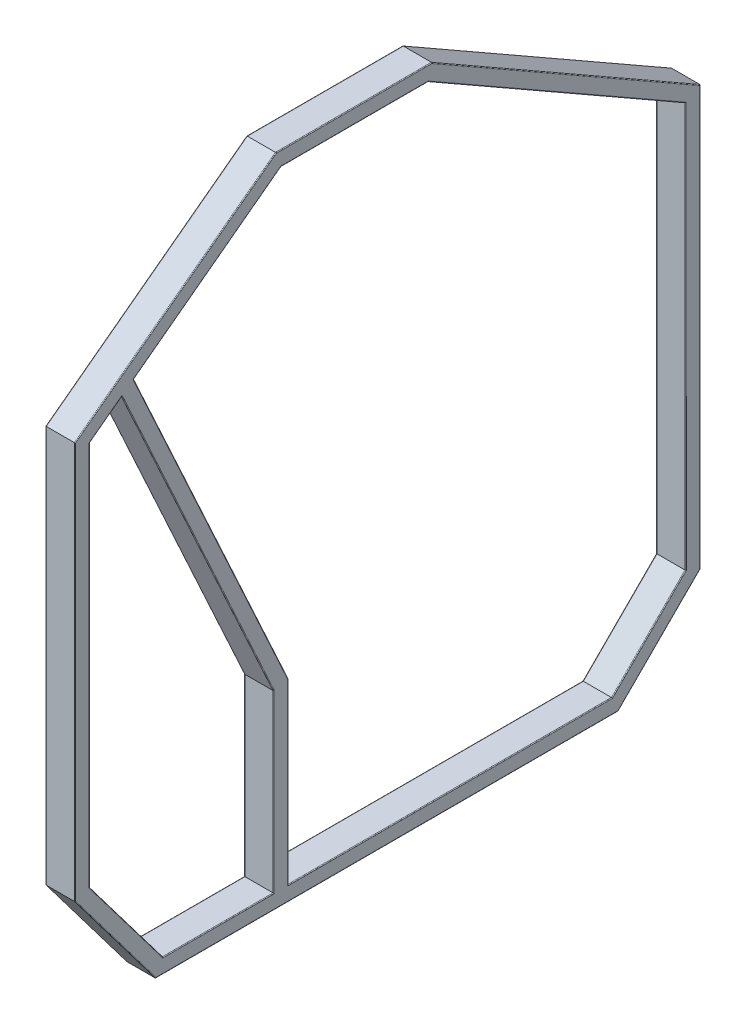
from build123d import *

# Parameters (mm, degrees)
BOSS_EXTRU_1_DEPTH = 80
COQUE1_START       = 4
COQUE1_DEPTH       = 72
CONG_2_R           = 2


# Read off the part's stored shape, not the designer's step: Coque1
with BuildPart() as part:
    # Esquisse1 → Boss.-Extru.1 (new body)
    with BuildSketch(Plane(origin=(0, 0, 0), x_dir=(0, 0, -1), z_dir=(1, 0, 0))):
        Polygon((740, 183.431457505), (740, 1323.212901419), (10.622577483, 1740), (-413.333333333, 1740), (-840, 1420), (-960, 1330), (-960, 250), (-740.540540541, -40), (-419.892357873, -40), (0, -40), (516.568542495, -40), align=None)
        Polygon((-420, 476.25814746), (-420, 26.428571429), (-420, 0), (-450.162628143, 0), (-554.571588527, 0), (-720.648182668, 0), (-920, 263.429187189), (-920, 1310), (-832.74112038, 1375.444159715), (-800, 1304.115290317), align=None, mode=Mode.SUBTRACT)
        Polygon((500, 0), (0, 0), (-380, 0), (-380, 485), (-400, 528.571428571), (-800, 1400), (-400, 1700), (0, 1700), (700, 1300), (700, 200), align=None, mode=Mode.SUBTRACT)
    extrude(amount=BOSS_EXTRU_1_DEPTH)

    # Coque1 outline → Coque1 (cut)
    with BuildSketch(Plane.YZ.offset(COQUE1_START)):
        Polygon((1736, -9.560319735), (1736, 412), (1328, 956), (251.342918719, 956), (-36, 738.551304753), (-36, -514.911688245), (185.088311755, -736), (1320.891611277, -736), align=None)
        Polygon((484.125814746, 384), (1401.263928167, 804.981429111), (1704, 401.333333333), (1704, -1.062257748), (1302.321290142, -704), (198.343145751, -704), (-4, -501.656854249), (-4, 384), align=None, mode=Mode.SUBTRACT)
        Polygon((262.08626847, 924), (1312, 924), (1381.619255939, 831.174325415), (477.132332714, 416), (-4, 416), (-4, 722.637418455), align=None, mode=Mode.SUBTRACT)
    extrude(amount=COQUE1_DEPTH, mode=Mode.SUBTRACT)

    # Congé2
    cong_2_edges = [part.edges().sort_by_distance(p)[0] for p in [
        (80, 942.5, 590),
        (80, 1550, 600),
        (80, 1700, 200),
        (0, 786.714593595, 920),
        (0, 131.714593595, 820.324091334),
        (80, 1500, -350),
        (0, 0, 570.324091334),
        (0, 238.12907373, 420),
        (0, 925.851153588, 626.37056019),
        (0, 1342.722079858, 876.37056019),
        (0, 1740, 201.355377925),
        (0, 1531.606450709, -375.311288741),
        (0, 753.322179462, -740),
        (80, 750, -700),
        (0, 71.715728753, -628.284271247),
        (0, -40, 111.985999023),
        (0, 105, 850.27027027),
        (0, 790, 960),
        (0, 1535, 686.666666667),
        (0, 0, -60),
        (0, 100, -600),
        (80, 100, -600),
        (0, 750, -700),
        (0, 1500, -350),
        (0, 1700, 200),
        (0, 1550, 600),
        (0, 942.5, 590),
        (0, 242.5, 380),
        (80, 0, -60),
        (80, 1535, 686.666666667),
        (80, 790, 960),
        (80, 105, 850.27027027),
        (80, -40, 111.985999023),
        (80, 71.715728753, -628.284271247),
        (80, 753.322179462, -740),
        (80, 1531.606450709, -375.311288741),
        (80, 242.5, 380),
        (76, 1346.80962797, 877.587162708),
        (4, 929.375794326, 623.587162708),
        (76, 236.566166357, 416),
        (76, -4, 569.318709227),
        (80, 1740, 201.355377925),
        (76, 129.043134235, 823.318709227),
        (76, 1532, 684),
        (76, 789.671459359, 956),
        (76, 107.67145936, 847.275652377),
        (76, -36, 111.819808254),
        (4, 74.544155878, -625.455844123),
        (76, 752.989961516, -736),
        (76, 1528.445805639, -372.780159868),
        (76, 240.062907373, 384),
        (76, 942.694871456, 594.490714556),
        (76, 1552.631964083, 603.157381222),
        (4, 1704, 200.135537793),
        (4, 1503.160645071, -352.531128874),
        (4, 750.332217947, -704),
        (76, 97.171572876, -602.828427124),
        (76, 1736, 201.219840132),
        (76, -4, -58.828427125),
        (76, 787.043134235, 924),
        (76, 1704, 200.135537793),
        (76, 1503.160645071, -352.531128874),
        (76, 750.332217947, -704),
        (76, 74.544155878, -625.455844123),
        (80, 1342.722079858, 876.37056019),
        (76, 929.375794326, 623.587162708),
        (4, 240.062907373, 384),
        (4, -4, -58.828427125),
        (4, 97.171572876, -602.828427124),
        (4, 1552.631964083, 603.157381222),
        (4, 942.694871456, 594.490714556),
        (4, 1532, 684),
        (4, 1736, 201.219840132),
        (4, 1528.445805639, -372.780159868),
        (4, 752.989961516, -736),
        (4, -36, 111.819808254),
        (4, 107.67145936, 847.275652377),
        (4, 789.671459359, 956),
        (4, 1346.80962797, 877.587162708),
        (4, 787.043134235, 924),
        (4, 129.043134235, 823.318709227),
        (4, -4, 569.318709227),
        (4, 236.566166357, 416),
        (80, 925.851153588, 626.37056019),
        (80, 238.12907373, 420),
        (80, 0, 570.324091334),
        (80, 131.714593595, 820.324091334),
        (80, 786.714593595, 920),
    ]]
    fillet(cong_2_edges, radius=CONG_2_R)


solid = part.part
